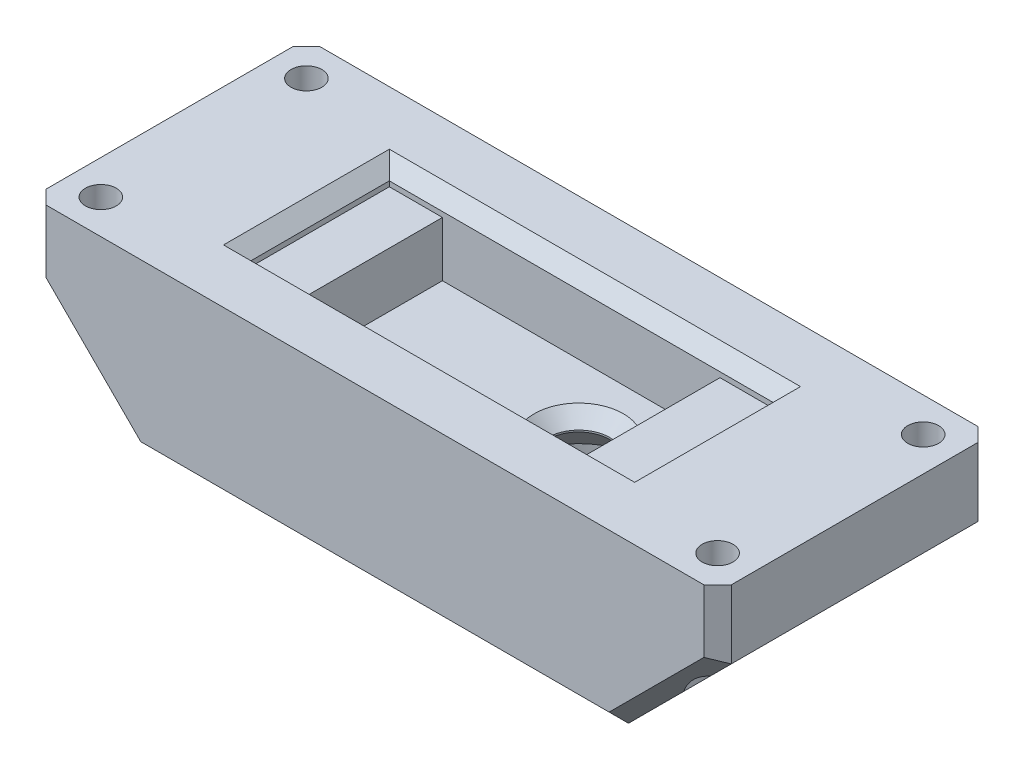
from build123d import *

# Parameters (mm, degrees)
SKETCH1_W           = 100
SKETCH1_H           = 40
BOSS_EXTRUDE1_DEPTH = 25
SKETCH2_R           = 2.25
CUT_EXTRUDE1_DEPTH  = 25
SKETCH3_R           = 3.55
CUT_EXTRUDE2_DEPTH  = 20
SKETCH4_W           = 56
SKETCH4_H           = 20.2
CUT_EXTRUDE3_DEPTH  = 2.75
SKETCH5_W           = 40.5
SKETCH5_H           = 20.2
CUT_EXTRUDE4_DEPTH  = 10.75
SKETCH6_R           = 4.5
CUT_EXTRUDE5_DEPTH  = 60.371710435
SKETCH7_R           = 11
CUT_EXTRUDE6_DEPTH  = 7
CHAMFER1_SIZE       = 5
CHAMFER2_SIZE       = 15
CHAMFER3_SIZE       = 2
CHAMFER4_SIZE       = 2
CHAMFER5_SIZE       = 2


with BuildPart() as part:
    # Sketch1 → Boss-Extrude1 (new body)
    with BuildSketch(Plane(origin=(0, 0, 0), x_dir=(1, 0, 0), z_dir=(0, 1, 0))):
        Rectangle(SKETCH1_W, SKETCH1_H)
    extrude(amount=BOSS_EXTRUDE1_DEPTH)

    # Sketch2 → Cut-Extrude1 (cut)
    with BuildSketch(Plane(origin=(0, 0, 0), x_dir=(1, 0, 0), z_dir=(0, 1, 0))):
        with Locations(Location((-45, -15, 0), (0, 0, 270))):
            Circle(SKETCH2_R)
        with Locations(Location((-45, 15, 0), (0, 0, 270))):
            Circle(SKETCH2_R)
    cut_extrude1 = extrude(amount=CUT_EXTRUDE1_DEPTH, mode=Mode.SUBTRACT)

    # Mirror1: Cut-Extrude1 across plane
    add(cut_extrude1.mirror(Plane(origin=(0, 0, 0), x_dir=(0, 0, 1), z_dir=(1, 0, 0))), mode=Mode.SUBTRACT)

    # Sketch3 → Cut-Extrude2 (cut)
    with BuildSketch(Plane(origin=(0, 0, 0), x_dir=(1, 0, 0), z_dir=(0, 1, 0))):
        with Locations(Location((-45, 15, 0), (0, 0, 270))):
            Circle(SKETCH3_R)
        with Locations(Location((-45, -15, 0), (0, 0, 270))):
            Circle(SKETCH3_R)
    cut_extrude2 = extrude(amount=CUT_EXTRUDE2_DEPTH, mode=Mode.SUBTRACT)

    # Mirror2: Cut-Extrude2 across plane
    add(cut_extrude2.mirror(Plane(origin=(0, 0, 0), x_dir=(0, 0, 1), z_dir=(1, 0, 0))), mode=Mode.SUBTRACT)

    # Sketch4 → Cut-Extrude3 (cut)
    with BuildSketch(Plane(origin=(0, 25, 0), x_dir=(1, 0, 0), z_dir=(0, 1, 0))):
        Rectangle(SKETCH4_W, SKETCH4_H)
    extrude(amount=-CUT_EXTRUDE3_DEPTH, mode=Mode.SUBTRACT)

    # Sketch5 → Cut-Extrude4 (cut)
    with BuildSketch(Plane(origin=(0, 25, 0), x_dir=(1, 0, 0), z_dir=(0, 1, 0))):
        Rectangle(SKETCH5_W, SKETCH5_H)
    extrude(amount=-CUT_EXTRUDE4_DEPTH, mode=Mode.SUBTRACT)

    # Sketch6 → Cut-Extrude5 (cut, through all)
    with BuildSketch(Plane(origin=(0, 25, 0), x_dir=(1, 0, 0), z_dir=(0, 1, 0))):
        with Locations(Location((9.75, 0, 0), (0, 0, 270))):
            Circle(SKETCH6_R)
    extrude(amount=-CUT_EXTRUDE5_DEPTH, mode=Mode.SUBTRACT)

    # Sketch7 → Cut-Extrude6 (cut)
    with BuildSketch(Plane(origin=(0, 0, 0), x_dir=(1, 0, 0), z_dir=(0, 1, 0))):
        with Locations(Location((9.75, 0, 0), (0, 0, 270))):
            Circle(SKETCH7_R)
    extrude(amount=CUT_EXTRUDE6_DEPTH, mode=Mode.SUBTRACT)

    # Chamfer1
    chamfer1_edges = [part.edges().sort_by_distance(p)[0] for p in [
        (9.75, 7, -4.5),
    ]]
    chamfer(chamfer1_edges, length=CHAMFER1_SIZE)

    # Chamfer2
    # the kernel refuses this chamfer: 15 mm, written as the material it takes off along each edge
    with BuildSketch(Plane(origin=(50, 0, -58.575244819), x_dir=(-0.9996219169112968, -0.02749587661058637, 0), z_dir=(0, 0, 1)), Plane(origin=(-50, 0, 58.575244819), x_dir=(0.9996219169112968, -0.02749587661058637, 0), z_dir=(0, 0, -1))) as chamfer2_piece_1:
        Polygon((CHAMFER2_SIZE * 0.999621916911, -CHAMFER2_SIZE * 0.0274958766106), (-CHAMFER2_SIZE * 0.0274958766106, -CHAMFER2_SIZE * 0.999621916911), (0, 0), align=None)
    extrude(amount=117.150489639, mode=Mode.SUBTRACT)

    # Chamfer3
    # the kernel refuses this chamfer: 2 mm, written as the material it takes off along each edge
    with BuildSketch(Plane(origin=(50, 9.856634024, -20), x_dir=(-0.9996219169112968, 0, -0.027495876610585647), z_dir=(0, 1, 0)), Plane(origin=(-50, 9.856634024, 20), x_dir=(0.9996219169112968, 0, 0.027495876610585647), z_dir=(0, 1, 0))) as chamfer3_piece_1:
        Polygon((CHAMFER3_SIZE * 0.999621916911, CHAMFER3_SIZE * 0.0274958766106), (-CHAMFER3_SIZE * 0.0274958766106, CHAMFER3_SIZE * 0.999621916911), (0, 0), align=None)
    extrude(amount=20.286731952, mode=Mode.SUBTRACT)
    with BuildSketch(Plane(origin=(31.36309104, -3.63690896, -20), x_dir=(0.01944252080602223, -0.01944252080600668, 0.9996219169112968), z_dir=(0.7071067811862648, 0.7071067811868302, 0))) as chamfer3_piece_2:
        Polygon((CHAMFER3_SIZE * 0.999621916911, -CHAMFER3_SIZE * 0.0274958766106), (-CHAMFER3_SIZE * 0.0274958766106, -CHAMFER3_SIZE * 0.999621916911), (0, 0), align=None)
    extrude(amount=31.499935387, mode=Mode.SUBTRACT)
    with BuildSketch(Plane(origin=(-40.143365976, 0, -20), x_dir=(0, -0.02749587661058639, 0.9996219169112968), z_dir=(1, 0, 0)), Plane(origin=(40.143365976, 0, 20), x_dir=(0, -0.02749587661058639, -0.9996219169112968), z_dir=(-1, 0, 0))) as chamfer3_piece_3:
        Polygon((CHAMFER3_SIZE * 0.999621916911, -CHAMFER3_SIZE * 0.0274958766106), (-CHAMFER3_SIZE * 0.0274958766106, -CHAMFER3_SIZE * 0.999621916911), (0, 0), align=None)
    extrude(amount=80.286731952, mode=Mode.SUBTRACT)
    with BuildSketch(Plane(origin=(-53.63690896, 18.63690896, -20), x_dir=(0.706839436070956, 0.7068394360703909, -0.02749587661058563), z_dir=(0.7071067811862648, -0.7071067811868302, 0)), Plane(origin=(-31.36309104, -3.63690896, 20), x_dir=(0.7068394360709562, 0.7068394360703909, 0.027495876610585616), z_dir=(-0.7071067811862648, 0.7071067811868302, 0)), Plane(origin=(53.63690896, 18.63690896, 20), x_dir=(-0.706839436070956, 0.7068394360703909, 0.02749587661058563), z_dir=(-0.7071067811862648, -0.7071067811868302, 0))) as chamfer3_piece_4:
        Polygon((CHAMFER3_SIZE * 0.999621916911, CHAMFER3_SIZE * 0.0274958766106), (-CHAMFER3_SIZE * 0.0274958766106, CHAMFER3_SIZE * 0.999621916911), (0, 0), align=None)
    extrude(amount=31.499935387, mode=Mode.SUBTRACT)
    with BuildSketch(Plane(origin=(-50, 9.856634024, -20), x_dir=(0.9996219169112968, 0, -0.027495876610585647), z_dir=(0, 1, 0)), Plane(origin=(50, 9.856634024, 20), x_dir=(-0.9996219169112968, 0, 0.027495876610585647), z_dir=(0, 1, 0))) as chamfer3_piece_5:
        Polygon((CHAMFER3_SIZE * 0.999621916911, -CHAMFER3_SIZE * 0.0274958766106), (-CHAMFER3_SIZE * 0.0274958766106, -CHAMFER3_SIZE * 0.999621916911), (0, 0), align=None)
    extrude(amount=20.286731952, mode=Mode.SUBTRACT)

    # Chamfer4
    chamfer4_edges = [part.edges().sort_by_distance(p)[0] for p in [
        (9.75, 14.25, -4.5),
    ]]
    chamfer(chamfer4_edges, length=CHAMFER4_SIZE)

    # Chamfer5
    chamfer5_edges = [part.edges().sort_by_distance(p)[0] for p in [
        (0, 25, -10.1),
        (-28, 25, 0),
        (0, 25, 10.1),
        (28, 25, 0),
    ]]
    chamfer(chamfer5_edges, length=CHAMFER5_SIZE)


solid = part.part
